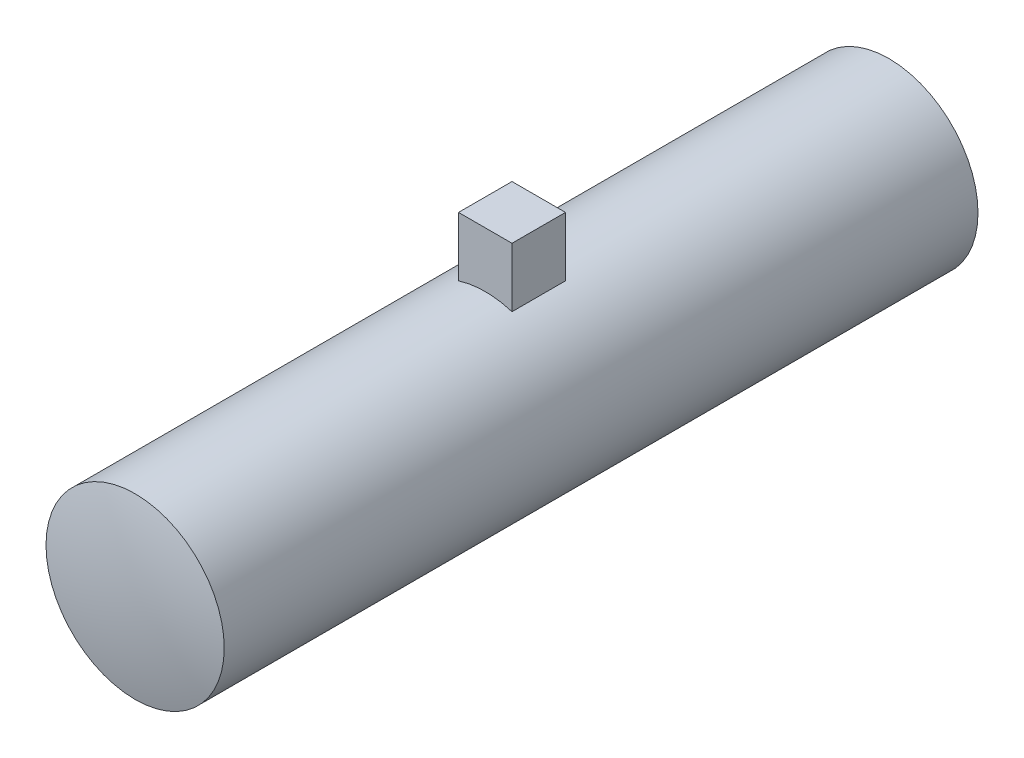
from build123d import *
from build123d.topology import SkipClean

# Parameters (mm, degrees)
BOSS_EXTRUDE1_DEPTH       = 2
CUT_EXTRUDE4_DEPTH        = 10
SKETCH6_W                 = 2
SKETCH6_H                 = 14.5
CUT_EXTRUDE5_DEPTH        = 10
SKETCH7_W                 = 12.5
SKETCH7_H                 = 12.5
BOSS_EXTRUDE2_DEPTH       = 2.5
SKETCH8_W                 = 2
SKETCH8_H                 = 2
BOSS_EXTRUDE3_DEPTH       = 41.5
CUT_EXTRUDE6_DEPTH        = 41.5
SKETCH10_W                = 2
SKETCH10_H                = 2
BOSS_EXTRUDE4_DEPTH       = 50.5
CUT_EXTRUDE7_DEPTH        = 50.5
SKETCH12_W                = 12.5
SKETCH12_H                = 12.5
BOSS_EXTRUDE5_DEPTH       = 2.5
CUT_EXTRUDE8_DEPTH        = 60.477411679
CUT_EXTRUDE8_DEPTH_BACK   = 2.5
SKETCH14_W                = 12.5
SKETCH14_H                = 12.5
BOSS_EXTRUDE6_DEPTH       = 2.5
SKETCH15_W                = 2
SKETCH15_H                = 2
BOSS_EXTRUDE7_DEPTH       = 39.5
SKETCH16_W                = 12.5
SKETCH16_H                = 12.5
BOSS_EXTRUDE8_DEPTH       = 2.5
SKETCH17_W                = 2
SKETCH17_H                = 12.5
BOSS_EXTRUDE9_DEPTH       = 2.5
SKETCH18_W                = 2
SKETCH18_H                = 12.5
CUT_EXTRUDE9_DEPTH        = 13.5
SKETCH19_W                = 2
SKETCH19_H                = 2
BOSS_EXTRUDE10_DEPTH      = 7.5
CUT_EXTRUDE11_DEPTH       = 33.5
CUT_EXTRUDE12_DEPTH       = 33.5
SKETCH22_W                = 2
SKETCH22_H                = 2
BOSS_EXTRUDE11_DEPTH      = 35.5
BOSS_EXTRUDE13_DEPTH      = 4
BOSS_EXTRUDE14_DEPTH      = 4
BOSS_EXTRUDE15_DEPTH      = 4
BOSS_EXTRUDE16_DEPTH      = 4
SKETCH28_R                = 4.5
SKETCH28_W                = 2
SKETCH28_H                = 2
BOSS_EXTRUDE17_DEPTH      = 57
SKETCH29_R                = 4.5
SKETCH29_W                = 2
SKETCH29_H                = 2
BOSS_EXTRUDE18_DEPTH      = 57
SKETCH30_R                = 4.5
SKETCH30_W                = 2
SKETCH30_H                = 2
BOSS_EXTRUDE19_DEPTH      = 57
SKETCH31_R                = 4.5
SKETCH31_W                = 2
SKETCH31_H                = 2
BOSS_EXTRUDE20_DEPTH      = 57
SKETCH32_W                = 122.959633523
SKETCH32_H                = 42.81362782
CUT_EXTRUDE13_DEPTH       = 57
BOSS_EXTRUDE21_DEPTH      = 1
CUT_EXTRUDE14_DEPTH       = 8
CUT_EXTRUDE15_DEPTH       = 8
CUT_EXTRUDE16_DEPTH       = 8
CUT_EXTRUDE17_DEPTH       = 8
BOSS_EXTRUDE22_DEPTH      = 1
BOSS_EXTRUDE23_DEPTH      = 2
BOSS_EXTRUDE23_DEPTH_BACK = 2
BOSS_EXTRUDE24_DEPTH      = 4
BOSS_EXTRUDE25_DEPTH      = 12.5
CUT_EXTRUDE18_DEPTH       = 12.5
SKETCH43_W                = 16
SKETCH43_H                = 2
CUT_EXTRUDE19_DEPTH       = 8.5
SKETCH44_R                = 1.5
CUT_EXTRUDE20_DEPTH       = 8.5
SKETCH45_R                = 9
BOSS_EXTRUDE27_DEPTH      = 20
CUT_EXTRUDE23_START       = -30
SKETCH50_R                = 9
CUT_EXTRUDE23_DEPTH       = 65
CUT_EXTRUDE24_DEPTH       = 65
CUT_EXTRUDE24_DEPTH_BACK  = 65
SKETCH52_W                = 56.65762051
SKETCH52_H                = 44.736687233
CUT_EXTRUDE25_DEPTH       = 65
CUT_EXTRUDE25_DEPTH_BACK  = 65
CUT_EXTRUDE26_DEPTH       = 65
CUT_EXTRUDE26_DEPTH_BACK  = 68
SKETCH56_R                = 43.614088274
SKETCH56_R_2              = 5
SKETCH57_R                = 5
CUT_EXTRUDE27_DEPTH       = 65
CUT_EXTRUDE28_DEPTH       = 17
CUT_EXTRUDE28_DEPTH_BACK  = 38
SKETCH58_R                = 5
CUT_EXTRUDE29_DEPTH       = 38
CUT_EXTRUDE30_DEPTH       = 38
CUT_EXTRUDE30_DEPTH_BACK  = 38
CUT_EXTRUDE36_DEPTH       = 79
CUT_EXTRUDE36_DEPTH_BACK  = 38
BOSS_EXTRUDE28_START      = -20
SKETCH62_W                = 3
SKETCH62_H                = 3
BOSS_EXTRUDE28_DEPTH      = 6


with BuildPart() as part:
    # Sketch4 → Boss-Extrude1 (new body)
    with BuildSketch(Plane.XY):
        Polygon((-2, 0), (-9, 0), (-15.226290525, 65), (-17.226290525, 65), (-11, 0), (-18, 0), (-24.539432883, 50), (-26.539432883, 50), (-20, 0), (-26, 0), (-26, -2), (15, -2), (15, 0), (9, 0), (13.425952869, 55), (11.425952869, 55), (7, 0), (0, 0), (0, 65), (-2, 65), align=None)
    extrude(amount=BOSS_EXTRUDE1_DEPTH)

    # Sketch5 → Cut-Extrude4 (cut)
    with BuildSketch(Plane.XY.offset(2)):
        Polygon((9.37564634, 55.872220493), (11.411691477, 54.822777915), (13.398823363, 54.662869695), (21.924639112, 53.976781356), (22.692490212, 57.613912627), (5.524505056, 72.3940809), (-16.325209023, 68.104380376), (-29.665618302, 62.849218827), (-29.083331676, 48.976254453), (-26.450573674, 49.320589338), (-24.484209654, 49.577767448), (-21.099856707, 50.020402427), (-24.484209654, 55.686609511), (-20.205422124, 64.224167275), (-17.179736544, 64.513994928), (-15.197920791, 64.703831246), (-10.585008306, 65.145697912), (2.587624418, 67.202095486), align=None)
    extrude(amount=-CUT_EXTRUDE4_DEPTH, mode=Mode.SUBTRACT)

    # Sketch6 → Cut-Extrude5 (cut)
    with BuildSketch(Plane.XY.offset(2)):
        Polygon((-22.603788855, 35.200214888), (-24.484209654, 49.577767448), (-26.450573674, 49.320589338), (-24.570152875, 34.943036778), align=None)
        Polygon((-13.815307691, 50.26989966), (-15.197920791, 64.703831246), (-17.179736544, 64.513994928), (-15.797123444, 50.080063343), align=None)
        with Locations((-1, 57.75)):
            Rectangle(SKETCH6_W, SKETCH6_H)
        Polygon((13.398823363, 54.662869695), (11.411691477, 54.822777915), (10.248609178, 40.369500101), (12.235741065, 40.209591881), align=None)
    extrude(amount=-CUT_EXTRUDE5_DEPTH, mode=Mode.SUBTRACT)

    # Sketch7 → Boss-Extrude2 (add)
    with BuildSketch(Plane(origin=(0, 50.5, 0), x_dir=(1, 0, 0), z_dir=(0, 1, 0))):
        with Locations((-1, -1)):
            Rectangle(SKETCH7_W, SKETCH7_H)
    extrude(amount=BOSS_EXTRUDE2_DEPTH)

    # Sketch8 → Boss-Extrude3 (add)
    with BuildSketch(Plane(origin=(3.293647576, 40.929178869, 0), x_dir=(0.9967777802722212, -0.08021257230374512, 0), z_dir=(0.08021257230374512, 0.9967777802722212, 0))):
        with Locations((11.977444462, -1)):
            Rectangle(SKETCH8_W, SKETCH8_H)
    extrude(amount=-BOSS_EXTRUDE3_DEPTH)

    # Sketch9 → Cut-Extrude6 (cut)
    with BuildSketch(Plane.XY.offset(2)):
        Polygon((7, 0), (9, 0), (12.235741065, 40.209591881), (10.248609178, 40.369500101), align=None)
    extrude(amount=-CUT_EXTRUDE6_DEPTH, mode=Mode.SUBTRACT)

    # Sketch10 → Boss-Extrude4 (add)
    with BuildSketch(Plane(origin=(-4.897136804, 51.124163089, 0), x_dir=(0.995443557626006, 0.09535262755100443, 0), z_dir=(-0.09535262755100443, 0.995443557626006, 0))):
        with Locations((-13.958992019, -1)):
            Rectangle(SKETCH10_W, SKETCH10_H)
    extrude(amount=-BOSS_EXTRUDE4_DEPTH)

    # Sketch11 → Cut-Extrude7 (cut)
    with BuildSketch(Plane.XY.offset(2)):
        Polygon((-11, 0), (-9, 0), (-13.815307691, 50.26989966), (-15.797123444, 50.080063343), align=None)
    extrude(amount=-CUT_EXTRUDE7_DEPTH, mode=Mode.SUBTRACT)

    # Sketch12 → Boss-Extrude5 (add)
    with BuildSketch(Plane(origin=(3.293647576, 40.929178869, 0), x_dir=(0.9967777802722212, -0.08021257230374557, 0), z_dir=(0.08021257230374557, 0.9967777802722213, 0))):
        with Locations((11.977444462, -1)):
            Rectangle(SKETCH12_W, SKETCH12_H)
    extrude(amount=BOSS_EXTRUDE5_DEPTH)

    # Sketch13 → Cut-Extrude8 (cut, two sides: drawn at the far end of the back side and taken through both)
    with BuildSketch(Plane.XY.offset(2).offset(-CUT_EXTRUDE8_DEPTH_BACK)):
        Polygon((-17.606376667, 47.897602035), (-17.797081922, 49.88848915), (-19.787969037, 49.697783895), (-19.637893395, 48.131053798), (-19.615531264, 47.897602035), (-19.597263782, 47.70689678), align=None)
    extrude(amount=CUT_EXTRUDE8_DEPTH + CUT_EXTRUDE8_DEPTH_BACK, mode=Mode.SUBTRACT)

    # Sketch14 → Boss-Extrude6 (add)
    with BuildSketch(Plane(origin=(-4.706431548, 49.133275974, 0), x_dir=(0.995443557626006, 0.0953526275510043, 0), z_dir=(-0.0953526275510043, 0.995443557626006, 0))):
        with Locations((-13.958992019, -1)):
            Rectangle(SKETCH14_W, SKETCH14_H)
    extrude(amount=BOSS_EXTRUDE6_DEPTH)



with BuildPart() as body_2:
    # Sketch15 → Boss-Extrude7 (new body)
    with BuildSketch(Plane(origin=(-4.906512673, 37.514817884, 0), x_dir=(0.9915553489661718, 0.12968419308679568, 0), z_dir=(-0.12968419308679568, 0.9915553489661719, 0))):
        with Locations((-30.847996281, -1)):
            Rectangle(SKETCH15_W, SKETCH15_H)
    extrude(amount=-BOSS_EXTRUDE7_DEPTH)

    # Sketch16 → Boss-Extrude8 (add)
    with BuildSketch(Plane(origin=(-4.906512673, 37.514817884, 0), x_dir=(0.9915553489661718, 0.1296841930867958, 0), z_dir=(-0.1296841930867958, 0.9915553489661719, 0))):
        with Locations((-30.847996281, -1)):
            Rectangle(SKETCH16_W, SKETCH16_H)
    extrude(amount=BOSS_EXTRUDE8_DEPTH)

    # Sketch17 → Boss-Extrude9 (add)
    with BuildSketch(Plane(origin=(-5.230723156, 39.993706257, 0), x_dir=(0.9915553489661718, 0.12968419308679563, 0), z_dir=(-0.12968419308679563, 0.9915553489661718, 0))):
        with Locations((-23.597996281, -1)):
            Rectangle(SKETCH17_W, SKETCH17_H)
    extrude(amount=-BOSS_EXTRUDE9_DEPTH)

    # Sketch18 → Cut-Extrude9 (cut)
    with BuildSketch(Plane(origin=(-5.230723156, 39.993706257, 0), x_dir=(0.9915553489661718, 0.12968419308679563, 0), z_dir=(-0.12968419308679563, 0.9915553489661718, 0))):
        with Locations((-36.097996281, -1)):
            Rectangle(SKETCH18_W, SKETCH18_H)
    extrude(amount=-CUT_EXTRUDE9_DEPTH, mode=Mode.SUBTRACT)


with BuildPart() as part_1:
    add(part.part)

    add(body_2.part)  # Boss-Extrude10 merges body 2
    # Sketch19 → Boss-Extrude10 (add)
    with BuildSketch(Plane.ZY.offset(26)):
        with Locations((1, -1)):
            Rectangle(SKETCH19_W, SKETCH19_H)
    extrude(amount=BOSS_EXTRUDE10_DEPTH)

    # Sketch20 → Cut-Extrude11 (cut)
    with BuildSketch(Plane.XY.offset(2)):
        Polygon((-31.857654672, -2), (-29.840621531, -2), (-29.379927415, -5.522431713), (-31.363038113, -5.781800099), align=None)
        Polygon((-20, 0), (-18, 0), (-22.603788855, 35.200214888), (-24.570152875, 34.943036778), align=None)
    extrude(amount=-CUT_EXTRUDE11_DEPTH, mode=Mode.SUBTRACT)

    # Sketch21 → Cut-Extrude12 (cut)
    with BuildSketch(Plane.XY.offset(2)):
        Polygon((-36.48556374, 33.384636185), (-34.502453042, 33.644004571), (-30.102198846, 0), (-32.119231987, 0), align=None)
    extrude(amount=-CUT_EXTRUDE12_DEPTH, mode=Mode.SUBTRACT)


with BuildPart() as cut_extrude12_piece_1:
    # of the separate pieces the step leaves, piece 1, a body of its own (cut_extrude12_pieces)
    add(part_1.part.solids().sort_by_distance((-15.027463791, 0, 0))[0])



with BuildPart() as cut_extrude12_piece_2:
    # of the separate pieces the step leaves, piece 2, a body of its own (cut_extrude12_pieces)
    add(part_1.part.solids().sort_by_distance((-40.032329107, 35.44205093, -5.25))[0])


with BuildPart() as cut_extrude12_piece_1_1:
    add(cut_extrude12_piece_1.part)

    add(cut_extrude12_piece_2.part)  # Boss-Extrude11 merges Cut-Extrude12 piece 2
    # Sketch22 → Boss-Extrude11 (add)
    with BuildSketch(Plane(origin=(-4.906512673, 37.514817884, 0), x_dir=(-0.9915553489661718, -0.12968419308679563, 0), z_dir=(0.12968419308679563, -0.9915553489661718, 0))):
        with Locations((28.847996281, -1)):
            Rectangle(SKETCH22_W, SKETCH22_H)
    extrude(amount=BOSS_EXTRUDE11_DEPTH)

    # Sketch24 → Boss-Extrude13 (add)
    with BuildSketch(Plane(origin=(18.168711631, -1.462070207, 0), x_dir=(0, 0, -1), z_dir=(0.9967777802722213, -0.08021257230374557, 0))):
        with BuildLine():
            Line((5.25, 43.561488006), (5.25, 49.561488006))
            ThreePointArc((5.25, 49.561488006), (-1, 55.538239219), (-7.25, 49.561488006))
            Line((-7.25, 49.561488006), (-7.25, 43.561488006))
            Line((-7.25, 43.561488006), (5.25, 43.561488006))
        make_face()
    extrude(amount=-BOSS_EXTRUDE13_DEPTH)

    # Sketch25 → Boss-Extrude14 (add)
    with BuildSketch(Plane(origin=(5.25, 0, 0), x_dir=(0, 0, -1), z_dir=(1, 0, 0))):
        with BuildLine():
            Line((-7.25, 53), (5.25, 53))
            Line((5.25, 53), (5.25, 59.612068966))
            ThreePointArc((5.25, 59.612068966), (-1, 65), (-7.25, 59.612068966))
            Line((-7.25, 59.612068966), (-7.25, 53))
        make_face()
    extrude(amount=-BOSS_EXTRUDE14_DEPTH)

    # Sketch26 → Boss-Extrude15 (add)
    with BuildSketch(Plane(origin=(-7.673866441, -0.735072645, 0), x_dir=(0, 0, -1), z_dir=(0.995443557626006, 0.0953526275510043, 0))):
        with BuildLine():
            Line((-7.25, 51.858173648), (5.25, 51.858173648))
            Line((5.25, 51.858173648), (5.25, 58.470242613))
            ThreePointArc((5.25, 58.470242613), (-1, 63.858173648), (-7.25, 58.470242613))
            Line((-7.25, 58.470242613), (-7.25, 51.858173648))
        make_face()
    extrude(amount=-BOSS_EXTRUDE15_DEPTH)

    # Sketch27 → Boss-Extrude16 (add)
    with BuildSketch(Plane(origin=(-22.407164089, -2.930602913, 0), x_dir=(0, 0, -1), z_dir=(0.9915553489661718, 0.12968419308679563, 0))):
        with BuildLine():
            Line((-7.25, 40.334315476), (5.25, 40.334315476))
            Line((5.25, 40.334315476), (5.25, 46.946384441))
            ThreePointArc((5.25, 46.946384441), (-1, 52.334315476), (-7.25, 46.946384441))
            Line((-7.25, 46.946384441), (-7.25, 40.334315476))
        make_face()
    extrude(amount=-BOSS_EXTRUDE16_DEPTH)

    # Sketch28 → Boss-Extrude17 (add)
    with BuildSketch(Plane(origin=(0, 50.5, 0), x_dir=(-1, 0, 0), z_dir=(0, -1, 0))):
        with Locations((1, -1)):
            Circle(SKETCH28_R)
        with Locations((1, -1)):
            Rectangle(SKETCH28_W, SKETCH28_H, mode=Mode.SUBTRACT)
    extrude(amount=BOSS_EXTRUDE17_DEPTH)

    # Sketch29 → Boss-Extrude18 (add)
    with BuildSketch(Plane(origin=(-4.706431548, 49.133275974, 0), x_dir=(-0.995443557626006, -0.09535262755100447, 0), z_dir=(0.09535262755100449, -0.9954435576260061, 0))):
        with Locations((13.958992019, -1)):
            Circle(SKETCH29_R)
        with Locations((13.958992019, -1)):
            Rectangle(SKETCH29_W, SKETCH29_H, mode=Mode.SUBTRACT)
    extrude(amount=BOSS_EXTRUDE18_DEPTH)

    # Sketch30 → Boss-Extrude19 (add)
    with BuildSketch(Plane(origin=(-4.906512673, 37.514817884, 0), x_dir=(0.9915553489661718, 0.12968419308679563, 0), z_dir=(0.12968419308679563, -0.9915553489661718, 0))):
        with Locations((-28.847996281, 1)):
            Circle(SKETCH30_R)
        with Locations((-28.847996281, 1)):
            Rectangle(SKETCH30_W, SKETCH30_H, mode=Mode.SUBTRACT)
    extrude(amount=BOSS_EXTRUDE19_DEPTH)

    # Sketch31 → Boss-Extrude20 (add)
    with BuildSketch(Plane(origin=(3.293647576, 40.929178869, 0), x_dir=(-0.9967777802722212, 0.08021257230374572, 0), z_dir=(-0.0802125723037457, -0.9967777802722211, 0))):
        with Locations((-11.977444462, -1)):
            Circle(SKETCH31_R)
        with Locations((-11.977444462, -1)):
            Rectangle(SKETCH31_W, SKETCH31_H, mode=Mode.SUBTRACT)
    extrude(amount=BOSS_EXTRUDE20_DEPTH)

    # Sketch32 → Cut-Extrude13 (cut)
    with BuildSketch(Plane.XZ.offset(2)):
        with Locations((-20.029572383, 0.792189378)):
            Rectangle(SKETCH32_W, SKETCH32_H)
    extrude(amount=CUT_EXTRUDE13_DEPTH, mode=Mode.SUBTRACT)

    # Sketch33 → Boss-Extrude21 (add)
    with BuildSketch(Plane(origin=(0, -2, 0), x_dir=(-1, 0, 0), z_dir=(0, -1, 0))):
        with BuildLine():
            Line((-14.023148824, -9), (30.976851176, -9))
            ThreePointArc((30.976851176, -9), (34.512385082, -7.535533906), (35.976851176, -4))
            Line((35.976851176, -4), (35.976851176, 2))
            ThreePointArc((35.976851176, 2), (34.512385082, 5.535533906), (30.976851176, 7))
            Line((30.976851176, 7), (-14.023148824, 7))
            ThreePointArc((-14.023148824, 7), (-17.55868273, 5.535533906), (-19.023148824, 2))
            Line((-19.023148824, 2), (-19.023148824, -4))
            ThreePointArc((-19.023148824, -4), (-17.55868273, -7.535533906), (-14.023148824, -9))
        make_face()
    extrude(amount=BOSS_EXTRUDE21_DEPTH)

    # Sketch34 → Cut-Extrude14 (cut)
    with BuildSketch(Plane(origin=(-26.373385485, -3.449339685, 0), x_dir=(0, 0, 1), z_dir=(-0.9915553489661718, -0.12968419308679557, 0))):
        with BuildLine():
            ThreePointArc((1, 45.434315476), (2.060660172, 45.873655304), (2.5, 46.934315476))
            ThreePointArc((2.5, 46.934315476), (-0.060660172, 47.994975647), (1, 45.434315476))
        make_face()
    extrude(amount=-CUT_EXTRUDE14_DEPTH, mode=Mode.SUBTRACT)

    # Sketch35 → Cut-Extrude15 (cut)
    with BuildSketch(Plane(origin=(-11.655640671, -1.116483155, 0), x_dir=(0, 0, 1), z_dir=(-0.995443557626006, -0.09535262755100442, 0))):
        with BuildLine():
            ThreePointArc((1, 56.958173648), (2.060660172, 57.397513476), (2.5, 58.458173648))
            ThreePointArc((2.5, 58.458173648), (-0.060660172, 59.51883382), (1, 56.958173648))
        make_face()
    extrude(amount=-CUT_EXTRUDE15_DEPTH, mode=Mode.SUBTRACT)

    # Sketch36 → Cut-Extrude16 (cut)
    with BuildSketch(Plane.ZY.offset(-1.25)):
        with BuildLine():
            ThreePointArc((1, 58.1), (2.060660172, 58.539339828), (2.5, 59.6))
            ThreePointArc((2.5, 59.6), (-0.060660172, 60.660660172), (1, 58.1))
        make_face()
    extrude(amount=-CUT_EXTRUDE16_DEPTH, mode=Mode.SUBTRACT)

    # Sketch37 → Cut-Extrude17 (cut)
    with BuildSketch(Plane(origin=(14.18160051, -1.141219918, 0), x_dir=(0, 0, 1), z_dir=(-0.9967777802722212, 0.08021257230374561, 0))):
        with BuildLine():
            ThreePointArc((1, 48.661488006), (2.060660172, 49.100827834), (2.5, 50.161488006))
            ThreePointArc((2.5, 50.161488006), (-0.060660172, 51.222148178), (1, 48.661488006))
        make_face()
    extrude(amount=-CUT_EXTRUDE17_DEPTH, mode=Mode.SUBTRACT)

    # Sketch38 → Boss-Extrude22 (add)
    with BuildSketch(Plane(origin=(0, -3, 0), x_dir=(-1, 0, 0), z_dir=(0, -1, 0))):
        with BuildLine():
            ThreePointArc((-14.023148824, -9), (-17.55868273, -7.535533906), (-19.023148824, -4))
            Line((-19.023148824, -4), (-19.023148824, -11))
            ThreePointArc((-19.023148824, -11), (-17.55868273, -14.535533906), (-14.023148824, -16))
            Line((-14.023148824, -16), (30.976851176, -16))
            ThreePointArc((30.976851176, -16), (34.512385082, -14.535533906), (35.976851176, -11))
            Line((35.976851176, -11), (35.976851176, -4))
            ThreePointArc((35.976851176, -4), (34.512385082, -7.535533906), (30.976851176, -9))
            Line((30.976851176, -9), (-14.023148824, -9))
        make_face()
    extrude(amount=-BOSS_EXTRUDE22_DEPTH)



with BuildPart() as body_2_2:
    # Sketch39 → Boss-Extrude23 (new, two sides: drawn at the far end of the back side and taken through both)
    with BuildSketch(Plane(origin=(0, -2, 0), x_dir=(1, 0, 0), z_dir=(0, 1, 0)).offset(-BOSS_EXTRUDE23_DEPTH_BACK)):
        Polygon((-30.0929677, -18.954951288), (-34.512385082, -14.535533906), (-38.931802465, -10.116116524), (-47.770637229, -18.954951288), (-39.165158063, -28.027141652), align=None)
    extrude(amount=BOSS_EXTRUDE23_DEPTH + BOSS_EXTRUDE23_DEPTH_BACK)


with BuildPart() as cut_extrude12_piece_1_2:
    add(cut_extrude12_piece_1_1.part)

    add(body_2_2.part)  # Boss-Extrude24 merges body 2 2
    # Sketch40 → Boss-Extrude24 (add)
    with BuildSketch(Plane(origin=(0, 0, 0), x_dir=(1, 0, 0), z_dir=(0, 1, 0))):
        Polygon((-35.976851176, -8.888761514), (-38.931802465, -10.116116524), (-30.0929677, -18.954951288), (-28.86561269, -16), align=None)
        Polygon((-39.165158063, -28.027141652), (-47.770637229, -18.954951288), (-50.245510964, -21.429825023), (-41.406676199, -30.268659787), align=None)
    extrude(amount=-BOSS_EXTRUDE24_DEPTH)

    # Sketch41 → Boss-Extrude25 (add)
    with BuildSketch(Plane(origin=(0, -2, 0), x_dir=(1, 0, 0), z_dir=(0, 1, 0))):
        Polygon((-44.235103323, -27.440232663), (-41.406676199, -30.268659787), (-32.567841434, -21.429825023), (-35.396268559, -18.601397898), align=None)
    extrude(amount=BOSS_EXTRUDE25_DEPTH)

    # Sketch42 → Cut-Extrude18 (cut)
    with BuildSketch(Plane(origin=(-8.39743533, 0, -8.39743533), x_dir=(-0.7071067811865478, 0, 0.7071067811865472), z_dir=(-0.7071067811865472, 0, -0.7071067811865478))):
        with BuildLine():
            ThreePointArc((50.68211612, 5.25), (44.43211612, 10.5), (38.18211612, 5.25))
            ThreePointArc((38.18211612, 5.25), (44.43211612, 16.808543829), (50.68211612, 5.25))
        make_face()
    extrude(amount=-CUT_EXTRUDE18_DEPTH, mode=Mode.SUBTRACT)

    # Sketch43 → Cut-Extrude19 (cut)
    with BuildSketch(Plane(origin=(-14.407842971, 0, -14.407842971), x_dir=(-0.7071067811865479, 0, 0.7071067811865472), z_dir=(-0.7071067811865472, 0, -0.7071067811865479))):
        with Locations((42.68211612, -1)):
            Rectangle(SKETCH43_W, SKETCH43_H)
    extrude(amount=-CUT_EXTRUDE19_DEPTH, mode=Mode.SUBTRACT)

    # Sketch44 → Cut-Extrude20 (cut)
    with BuildSketch(Plane(origin=(-8.39743533, 0, -8.39743533), x_dir=(-0.7071067811865478, 0, 0.7071067811865472), z_dir=(-0.7071067811865472, 0, -0.7071067811865478))):
        with Locations((44.43211612, 4.6)):
            Circle(SKETCH44_R)
    extrude(amount=-CUT_EXTRUDE20_DEPTH, mode=Mode.SUBTRACT)

    # Sketch45 → Boss-Extrude27 (add)
    with BuildSketch(Plane(origin=(0, -3, 0), x_dir=(-1, 0, 0), z_dir=(0, -1, 0))):
        with Locations((8.476851176, -4.5)):
            Circle(SKETCH45_R)
    extrude(amount=BOSS_EXTRUDE27_DEPTH)


with BuildPart() as body_2_3:
    # Sketch46 → Revolve1 (revolve)
    with BuildSketch(Plane.XY):
        with BuildLine():
            Line((-8.476851176, -45.826430986), (-8.476851176, -89.289265837))
            ThreePointArc((-8.476851176, -89.289265837), (13.254566249, -67.557848412), (-8.476851176, -45.826430986))
        make_face()
    revolve(axis=Axis((-8.476851176, -45.826430986, 0), (0, -1, 0)))

    # Sketch50 → Cut-Extrude23 (cut)
    with BuildSketch(Plane(origin=(0, 0, 0), x_dir=(1, 0, 0), z_dir=(0, 1, 0)).offset(CUT_EXTRUDE23_START)):
        with Locations((-8.476851176, 0)):
            Circle(SKETCH50_R)
    extrude(amount=-CUT_EXTRUDE23_DEPTH, mode=Mode.SUBTRACT)

    # Sketch52 → Cut-Extrude24 (cut, two sides: drawn at the far end of the back side and taken through both)
    with BuildSketch(Plane(origin=(0, 0, 0), x_dir=(0, 0, -1), z_dir=(1, 0, 0)).offset(-CUT_EXTRUDE24_DEPTH_BACK)):
        with Locations((0, -67.557848412)):
            Rectangle(SKETCH52_W, SKETCH52_H)
        Polygon((-10.161758641, -47.777694132), (0, -47.777694132), (10.161758641, -47.777694132), (10.161758641, -87.338002691), (0, -87.338002691), (-10.161758641, -87.338002691), align=None, mode=Mode.SUBTRACT)
    extrude(amount=CUT_EXTRUDE24_DEPTH + CUT_EXTRUDE24_DEPTH_BACK, mode=Mode.SUBTRACT)

    # Sketch57 → Cut-Extrude27 (cut)
    with BuildSketch(Plane.XY.offset(10.161758641)):
        with Locations((-8.476851176, -67.557848412)):
            Circle(SKETCH57_R)
    extrude(amount=-CUT_EXTRUDE27_DEPTH, mode=Mode.SUBTRACT)

    # Sketch59 → Cut-Extrude29 (cut)
    with BuildSketch(Plane.XY.offset(10.161758641)):
        Polygon((-2.226851176, -67.557848412), (-2.226851176, -73.807848412), (-14.726851176, -73.807848412), (-14.726851176, -67.557848412), (-40.012372079, -67.557848412), (-40.012372079, -94.995810902), (23.058669727, -94.995810902), (23.058669727, -67.557848412), align=None)
    extrude(amount=-CUT_EXTRUDE29_DEPTH, mode=Mode.SUBTRACT)


with BuildPart() as body_3:
    # Sketch53 → Revolve2 (revolve)
    with BuildSketch(Plane(origin=(0, 0, 0), x_dir=(1, 0, 0), z_dir=(0, 1, 0))):
        with BuildLine():
            Line((-8.800357803, -28.92805964), (-8.800357803, -72.38805964))
            ThreePointArc((-8.800357803, -72.38805964), (-30.530357803, -50.65805964), (-8.800357803, -28.92805964))
        make_face()
    revolve(axis=Axis((-8.800357803, 0, 28.92805964), (0, 0, 1)))

    # Sketch54 → Cut-Extrude25 (cut, two sides: drawn at the far end of the back side and taken through both)
    with SkipClean():  # the faces are left unmerged after this step: merging them gives an invalid solid
        with BuildSketch(Plane(origin=(0, 0, 0), x_dir=(1, 0, 0), z_dir=(0, 1, 0)).offset(-CUT_EXTRUDE25_DEPTH_BACK)):
            with BuildLine():
                ThreePointArc((-18.960357803, -69.866581186), (-14.034463591, -71.748271507), (-8.800357803, -72.38805964))
                ThreePointArc((-8.800357803, -72.38805964), (-3.566252015, -71.748271507), (1.359642197, -69.866581186))
                Line((1.359642197, -69.866581186), (1.359642197, -31.449538093))
                ThreePointArc((1.359642197, -31.449538093), (-3.566252019, -29.567847772), (-8.80035781, -28.92805964))
                ThreePointArc((-8.80035781, -28.92805964), (-14.034463594, -29.567847773), (-18.960357803, -31.449538093))
                Line((-18.960357803, -31.449538093), (-18.960357803, -69.866581186))
            make_face()
        extrude(amount=CUT_EXTRUDE25_DEPTH + CUT_EXTRUDE25_DEPTH_BACK, mode=Mode.SUBTRACT)


with BuildPart() as cut_extrude25_piece_1:
    # of the separate pieces the step leaves, piece 1, a body of its own (cut_extrude25_pieces)
    add(body_3.part.solids().sort_by_distance((1.359642197, -2.431e-06, 31.449538093))[0])


with BuildPart() as cut_extrude25_piece_2:
    # of the separate pieces the step leaves, piece 2, a body of its own (cut_extrude25_pieces)
    add(body_3.part.solids().sort_by_distance((-18.960357803, 0, 69.866581186))[0])


with BuildPart() as body_5:
    # Sketch55 → Revolve3 (revolve)
    with BuildSketch(Plane.XY):
        with BuildLine():
            Line((67.523973483, -43.825779011), (67.523973483, -0.365779011))
            ThreePointArc((67.523973483, -0.365779011), (45.793973483, -22.095779011), (67.523973483, -43.825779011))
        make_face()
    revolve(axis=Axis((67.523973483, -43.825779011, 0), (0, 1, 0)))

    # Sketch56 → Cut-Extrude26 (cut, two sides: drawn at the far end of the back side and taken through both)
    with BuildSketch(Plane.XY.offset(-CUT_EXTRUDE26_DEPTH_BACK)):
        with Locations((67.523973483, -22.095779011)):
            Circle(SKETCH56_R)
        with Locations((67.523973483, -22.095779011)):
            Circle(SKETCH56_R_2, mode=Mode.SUBTRACT)
    extrude(amount=CUT_EXTRUDE26_DEPTH + CUT_EXTRUDE26_DEPTH_BACK, mode=Mode.SUBTRACT)

    # Sketch62 → Boss-Extrude28 (add)
    with BuildSketch(Plane(origin=(0, 0, 0), x_dir=(1, 0, 0), z_dir=(0, 1, 0)).offset(BOSS_EXTRUDE28_START)):
        with Locations((67.523973483, 0)):
            Rectangle(SKETCH62_W, SKETCH62_H)
    extrude(amount=BOSS_EXTRUDE28_DEPTH)


with BuildPart() as cut_extrude28_tool:
    # Sketch58 → Cut-Extrude28 (new, two sides: drawn at the far end of the back side and taken through both)
    with SkipClean():  # the faces are left unmerged after this step: merging them gives an invalid solid
        with BuildSketch(Plane(origin=(0, 0, 0), x_dir=(0, 0, -1), z_dir=(1, 0, 0)).offset(-CUT_EXTRUDE28_DEPTH_BACK)):
            with Locations((-50.65805964, 0)):
                Circle(SKETCH58_R)
        extrude(amount=CUT_EXTRUDE28_DEPTH + CUT_EXTRUDE28_DEPTH_BACK)


with BuildPart() as cut_extrude25_piece_1_1:
    with SkipClean():  # the faces are left unmerged after this step: merging them gives an invalid solid
        add(cut_extrude25_piece_1.part)

        # Cut-Extrude28: cut by cut_extrude28_tool
        add(cut_extrude28_tool.part, mode=Mode.SUBTRACT)


with BuildPart() as cut_extrude25_piece_2_1:
    with SkipClean():  # the faces are left unmerged after this step: merging them gives an invalid solid
        add(cut_extrude25_piece_2.part)

        # Cut-Extrude28: cut by cut_extrude28_tool
        add(cut_extrude28_tool.part, mode=Mode.SUBTRACT)


with BuildPart() as cut_extrude30_tool:
    # Sketch60 → Cut-Extrude30 (new, two sides: drawn at the far end of the back side and taken through both)
    with BuildSketch(Plane(origin=(-18.960357803, 0, 0), x_dir=(0, 0, -1), z_dir=(1, 0, 0)).offset(-CUT_EXTRUDE30_DEPTH_BACK)):
        Polygon((-26.705466863, -24.826098639), (-26.705466863, 0), (-44.40805964, 0), (-44.40805964, -6.25), (-56.90805964, -6.25), (-56.90805964, 0), (-74.610652417, 0), (-74.610652417, -24.826098639), align=None)
    extrude(amount=CUT_EXTRUDE30_DEPTH + CUT_EXTRUDE30_DEPTH_BACK)


with BuildPart() as cut_extrude12_piece_1_3:
    add(cut_extrude12_piece_1_2.part)

    # Cut-Extrude30: cut by cut_extrude30_tool
    add(cut_extrude30_tool.part, mode=Mode.SUBTRACT)


with BuildPart() as cut_extrude25_piece_1_2:
    add(cut_extrude25_piece_1_1.part)

    # Cut-Extrude30: cut by cut_extrude30_tool
    add(cut_extrude30_tool.part, mode=Mode.SUBTRACT)


with BuildPart() as cut_extrude25_piece_2_2:
    add(cut_extrude25_piece_2_1.part)

    # Cut-Extrude30: cut by cut_extrude30_tool
    add(cut_extrude30_tool.part, mode=Mode.SUBTRACT)


with BuildPart() as cut_extrude36_tool:
    # Sketch61 → Cut-Extrude36 (new, two sides: drawn at the far end of the back side and taken through both)
    with BuildSketch(Plane.XY.offset(-CUT_EXTRUDE36_DEPTH_BACK)):
        Polygon((36.856010868, 69.554774267), (-56.142006645, 69.554774267), (-56.142006645, -105.644942173), (31.122269385, -105.644942173), (31.122269385, -34.697128753), (36.856010868, -34.697128753), align=None)
    extrude(amount=CUT_EXTRUDE36_DEPTH + CUT_EXTRUDE36_DEPTH_BACK)


with BuildPart() as cut_extrude12_piece_1_4:
    add(cut_extrude12_piece_1_3.part)

    # Cut-Extrude36: cut by cut_extrude36_tool
    add(cut_extrude36_tool.part, mode=Mode.SUBTRACT)


with BuildPart() as body_2_3_1:
    add(body_2_3.part)

    # Cut-Extrude36: cut by cut_extrude36_tool
    add(cut_extrude36_tool.part, mode=Mode.SUBTRACT)


with BuildPart() as cut_extrude25_piece_1_3:
    add(cut_extrude25_piece_1_2.part)

    # Cut-Extrude36: cut by cut_extrude36_tool
    add(cut_extrude36_tool.part, mode=Mode.SUBTRACT)


with BuildPart() as cut_extrude25_piece_2_3:
    add(cut_extrude25_piece_2_2.part)

    # Cut-Extrude36: cut by cut_extrude36_tool
    add(cut_extrude36_tool.part, mode=Mode.SUBTRACT)


solid = body_5.part
